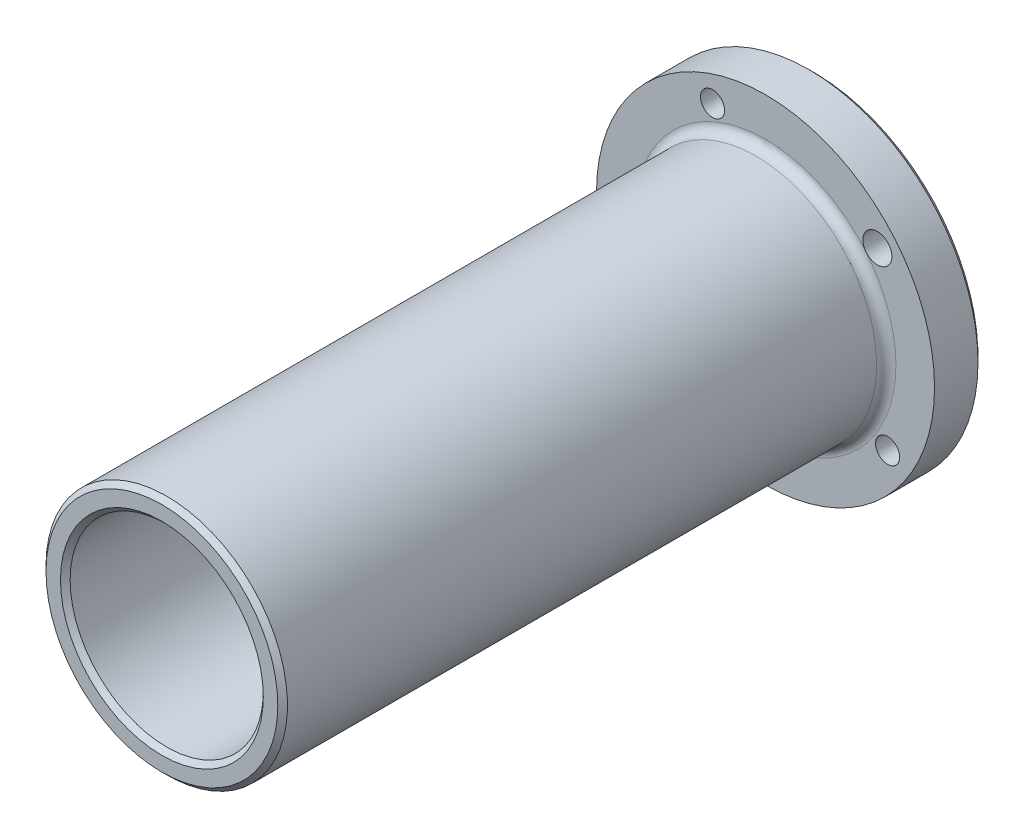
from build123d import *

# Parameters (mm, degrees)
SKETCH_1_R                = 35
EXTRUDE_1_DEPTH           = 5
SKETCH_2_R                = 25
EXTRUDE_2_DEPTH           = 135
SKETCH_4_R                = 35
CUT_EXTRUDE_2_DEPTH       = 5
SKETCH_9_R                = 35
EXTRUDE_3_DEPTH           = 10
CHAMFER_1_SIZE            = 1
HOLE_WIZARD_M6_1_D        = 5
HOLE_WIZARD_M6_1_DEPTH    = 25
HOLE_WIZARD_M6_1_TIP      = 1.502151548
HOLE_WIZARD_6_0_6_1_D     = 6
HOLE_WIZARD_6_0_6_1_DEPTH = 20
HOLE_WIZARD_6_0_6_1_TIP   = 1.802581857
CHAMFER_2_SIZE            = 0.5
SKETCH_10_R               = 20
CUT_EXTRUDE_3_DEPTH       = 175.570902501
FILLET_1_R                = 2
CHAMFER_3_SIZE            = 1


with BuildPart() as part:
    # 草图1 → 凸台-拉伸1 (new body)
    with BuildSketch(Plane.XY):
        with Locations((70, 0)):
            Circle(SKETCH_1_R)
    extrude(amount=EXTRUDE_1_DEPTH)

    # 草图2 → 凸台-拉伸2 (add)
    with BuildSketch(Plane(origin=(0, 0, 0), x_dir=(-1, 0, 0), z_dir=(0, 0, -1))):
        with Locations(Location((-70, 0, 0), (0, 0, 180))):
            Circle(SKETCH_2_R)
    extrude(amount=EXTRUDE_2_DEPTH)

    # 草图4 → 切除-拉伸2 (cut)
    with BuildSketch(Plane(origin=(0, 0, 0), x_dir=(-1, 0, 0), z_dir=(0, 0, -1))):
        with Locations((-70, 0)):
            Circle(SKETCH_4_R)
    extrude(amount=-CUT_EXTRUDE_2_DEPTH, mode=Mode.SUBTRACT)

    # 草图9 → 凸台-拉伸3 (add)
    with BuildSketch(Plane(origin=(0, 0, -135), x_dir=(-1, 0, 0), z_dir=(0, 0, -1))):
        with Locations((-70, 0)):
            Circle(SKETCH_9_R)
    extrude(amount=-EXTRUDE_3_DEPTH)

    # 倒角1
    chamfer_1_edges = [part.edges().sort_by_distance(p)[0] for p in [
        (105, 0, -135),
        (45, 0, 0),
    ]]
    chamfer(chamfer_1_edges, length=CHAMFER_1_SIZE)

    # M6 螺纹孔1
    with Locations(Plane(origin=(0, 0, -135), x_dir=(-1, 0, 0), z_dir=(0, 0, -1))):
        with Locations((-62.458195458, -29.036549111), (-95.284853471, -16.145469487), (-59.034192698, 27.924023174), (-40.054054986, -1.800104779)):
            Hole(HOLE_WIZARD_M6_1_D / 2, depth=HOLE_WIZARD_M6_1_DEPTH)
            with Locations((0, 0, -(HOLE_WIZARD_M6_1_DEPTH + HOLE_WIZARD_M6_1_TIP / 2))):  # 118° drill point
                Cone(0, HOLE_WIZARD_M6_1_D / 2, HOLE_WIZARD_M6_1_TIP, mode=Mode.SUBTRACT)

    # Ø6.0 (6) 直径孔1
    with Locations(Plane(origin=(0, 0, -135), x_dir=(-1, 0, 0), z_dir=(0, 0, -1))):
        with Locations((-93.168703387, 19.058100203)):
            Hole(HOLE_WIZARD_6_0_6_1_D / 2, depth=HOLE_WIZARD_6_0_6_1_DEPTH)
            with Locations((0, 0, -(HOLE_WIZARD_6_0_6_1_DEPTH + HOLE_WIZARD_6_0_6_1_TIP / 2))):  # 118° drill point
                Cone(0, HOLE_WIZARD_6_0_6_1_D / 2, HOLE_WIZARD_6_0_6_1_TIP, mode=Mode.SUBTRACT)

    # 倒角2
    chamfer_2_edges = [part.edges().sort_by_distance(p)[0] for p in [
        (90.168703387, 19.058100203, -135),
    ]]
    chamfer(chamfer_2_edges, length=CHAMFER_2_SIZE)

    # 草图10 → 切除-拉伸3 (cut, through all)
    with BuildSketch(Plane(origin=(0, 0, -135), x_dir=(-1, 0, 0), z_dir=(0, 0, -1))):
        with Locations((-70, 0)):
            Circle(SKETCH_10_R)
    extrude(amount=-CUT_EXTRUDE_3_DEPTH, mode=Mode.SUBTRACT)

    # 圆角1
    fillet_1_edges = [part.edges().sort_by_distance(p)[0] for p in [
        (45, 0, -125),
    ]]
    fillet(fillet_1_edges, radius=FILLET_1_R - 0.0001)  # a hair under: the kernel refuses the full size

    # 倒角3
    chamfer_3_edges = [part.edges().sort_by_distance(p)[0] for p in [
        (90, 0, 0),
        (90, 0, -135),
    ]]
    chamfer(chamfer_3_edges, length=CHAMFER_3_SIZE)


solid = part.part
